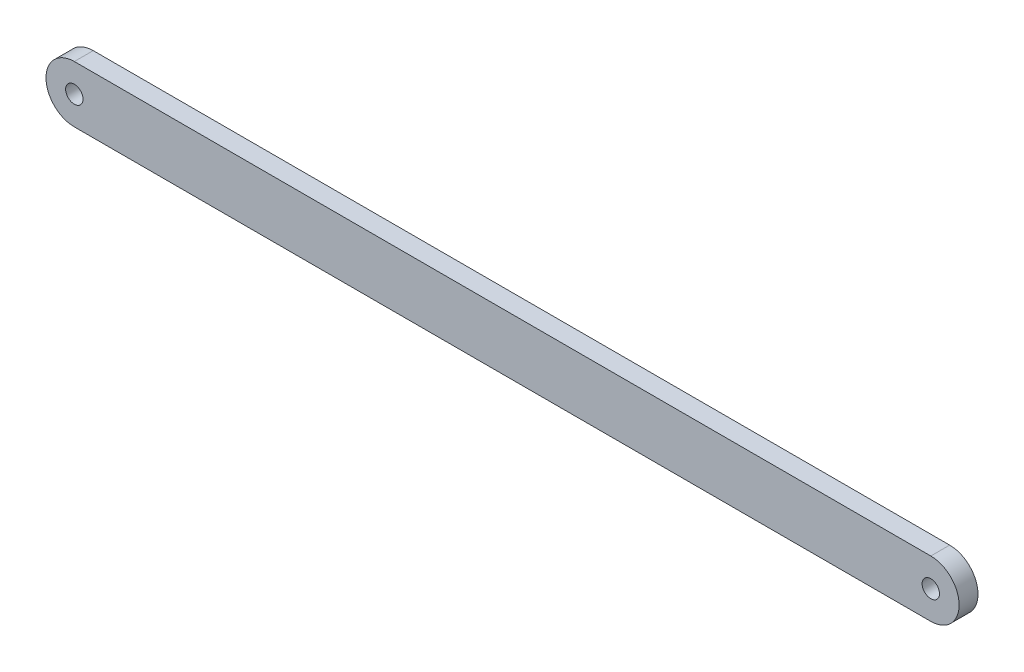
from build123d import *

# Parameters (mm, degrees)
SKETCH_1_R      = 2.3
EXTRUDE_1_DEPTH = 5


with BuildPart() as part:
    # 草图1 → 凸台-拉伸1 (new body)
    with BuildSketch(Plane.XY):
        with BuildLine():
            Line((-113.4, 7.5), (113.4, 7.5))
            ThreePointArc((113.4, 7.5), (120.9, 0), (113.4, -7.5))
            Line((113.4, -7.5), (-113.4, -7.5))
            ThreePointArc((-113.4, -7.5), (-120.9, 0), (-113.4, 7.5))
        make_face()
        with Locations((-113.4, 0)):
            Circle(SKETCH_1_R, mode=Mode.SUBTRACT)
        with Locations((113.4, 0)):
            Circle(SKETCH_1_R, mode=Mode.SUBTRACT)
    extrude(amount=EXTRUDE_1_DEPTH)


solid = part.part
